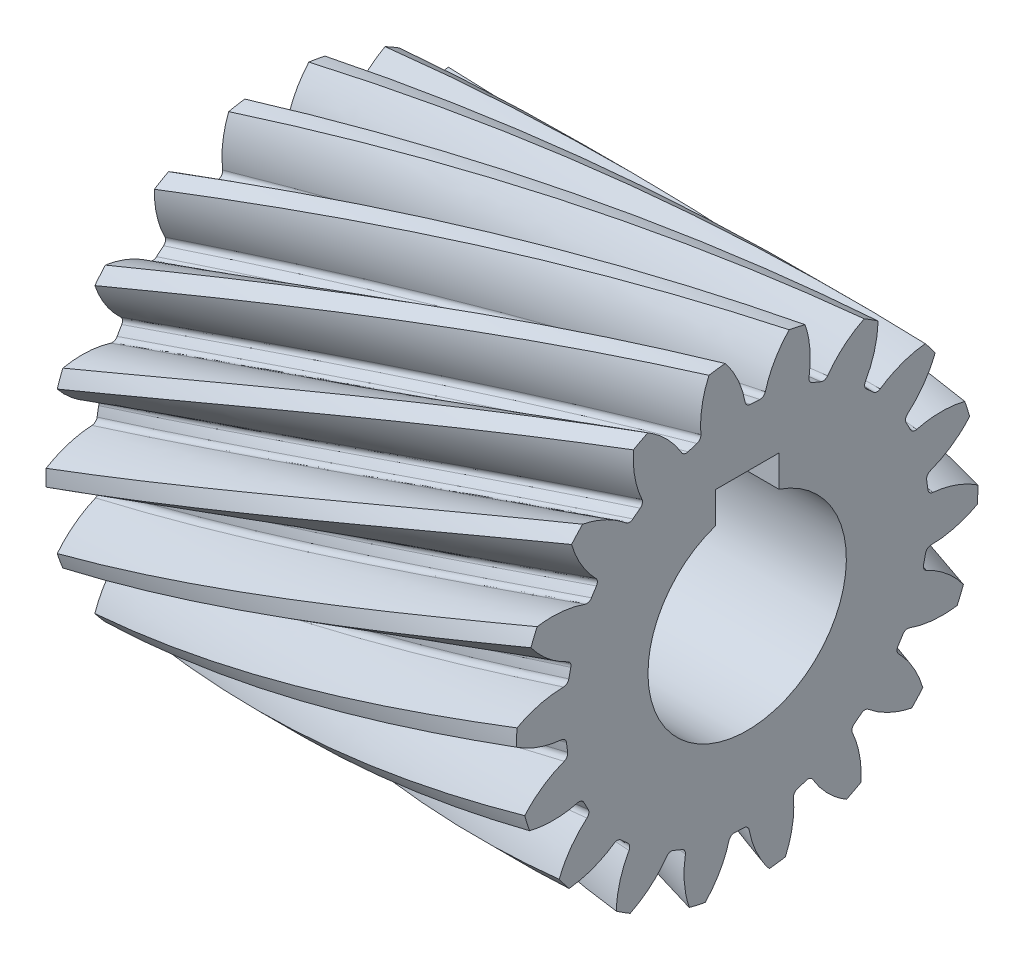
from build123d import *

# Parameters (mm, degrees)
BASPROSKE_W            = 59.275
BASPROSKE_H            = 29.088399869
TOOTHCUTLH_PITCH       = 502.150421815
TOOTHCUTLH_HEIGHT      = 59.275
TOOTHCUTLH_RADIUS      = 29.088399869
TOOTHCUTLH_START_ANGLE = -90
TEETHCUTSLH_COUNT      = 18
TEETHCUTSLH_ANGLE      = 340
BORSKE_R               = 12.5
BORE_DEPTH             = 74.0937525
KEYSKE_W               = 8
KEYSKE_H               = 15.8
KEYWAY_DEPTH           = 74.0937525


with BuildPart() as part:
    # BasProSke → Base-Revolve (revolve)
    with BuildSketch(Plane(origin=(0, 0, 0), x_dir=(1, 0, 0), z_dir=(0, 1, 0)), mode=Mode.PRIVATE) as base_revolve_sk:
        with Locations((29.6375, 14.544199935)):
            Rectangle(BASPROSKE_W, BASPROSKE_H)
    revolve(base_revolve_sk.sketch.rotate(Axis((-10, 0, 0), (1, 0, 0)), 180), axis=Axis((-10, 0, 0), (1, 0, 0)))

    # ToothCutLH: sweep along a helix
    with BuildLine() as toothcutlh_path:
        add(Helix(TOOTHCUTLH_PITCH, TOOTHCUTLH_HEIGHT, TOOTHCUTLH_RADIUS, center=(0, 0, 0), direction=(1, 0, 0), lefthand=True, mode=Mode.PRIVATE).rotate(Axis((0, 0, 0), (1, 0, 0)), TOOTHCUTLH_START_ANGLE))
    # TooCutSkeRH<3> → ToothCutLH (sweep, cut)
    with BuildSketch(Plane(origin=(0, 0, 0), x_dir=(0, 0, -1), z_dir=(1, 0, 0))):
        with BuildLine():
            ThreePointArc((0.581139397, 22.893525106), (0, 22.900899869), (-0.581139397, 22.893525106))
            ThreePointArc((-0.581139397, 22.893525106), (-1.020096283, 23.037393276), (-1.26932548, 23.426322583))
            ThreePointArc((-1.26932548, 23.426322583), (-2.572631773, 26.758289019), (-4.774670131, 29.578153323))
            ThreePointArc((-4.774670131, 29.578153323), (0, 29.961051865), (4.774670131, 29.578153323))
            ThreePointArc((4.774670131, 29.578153323), (2.572631773, 26.758289019), (1.26932548, 23.426322583))
            ThreePointArc((1.26932548, 23.426322583), (1.020096283, 23.037393276), (0.581139397, 22.893525106))
        make_face()
    toothcutlh = sweep(path=toothcutlh_path.line, is_frenet=True, mode=Mode.SUBTRACT)

    # TeethCutsLH: ToothCutLH ×18 about axis
    teethcutslh_axis = Axis((-10, 0, 0), (1, 0, 0))
    for i in range(1, TEETHCUTSLH_COUNT):
        add(toothcutlh.rotate(teethcutslh_axis, i * TEETHCUTSLH_ANGLE / (TEETHCUTSLH_COUNT - 1)), mode=Mode.SUBTRACT)

    # BorSke → Bore (cut, symmetric)
    with BuildSketch(Plane(origin=(0, 0, 0), x_dir=(0, 0, -1), z_dir=(1, 0, 0))):
        with Locations(Location((0, 0, 0), (0, 0, 180))):
            Circle(BORSKE_R)
    extrude(amount=BORE_DEPTH, both=True, mode=Mode.SUBTRACT)

    # KeySke → Keyway (cut, symmetric)
    with BuildSketch(Plane(origin=(0, 0, 0), x_dir=(0, 0, -1), z_dir=(1, 0, 0))):
        with Locations((0, 7.9)):
            Rectangle(KEYSKE_W, KEYSKE_H)
    extrude(amount=KEYWAY_DEPTH, both=True, mode=Mode.SUBTRACT)


solid = part.part
